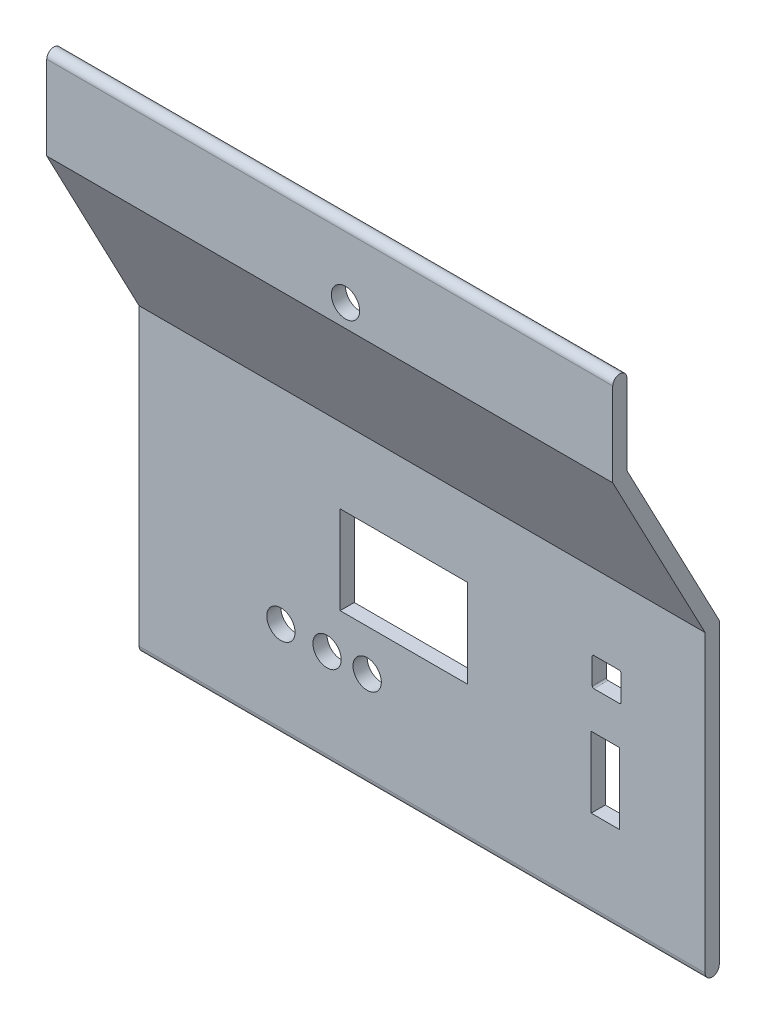
from build123d import *

# Parameters (mm, degrees)
SALIENTE_EXTRUIR3_DEPTH      = 110
SALIENTE_EXTRUIR3_DEPTH_BACK = 10
CORTAR_EXTRUIR3_START        = -3
CORTAR_EXTRUIR3_OUTLINE_R    = 3
CORTAR_EXTRUIR3_DEPTH        = 22.583018394


# Read off the part's stored shape, not the designer's step: Cortar-Extruir3
with BuildPart() as part:
    # Croquis9 → Saliente-Extruir3 (new, two sides: drawn at the far end of the back side and taken through both)
    with BuildSketch(Plane(origin=(0, 0, 0), x_dir=(0, 0, -1), z_dir=(1, 0, 0)).offset(-SALIENTE_EXTRUIR3_DEPTH_BACK)):
        with BuildLine():
            Line((5.538630524, -12.462), (5.538630524, 50.038))
            Line((5.538630524, 50.038), (-14.04438787, 87.324884341))
            Line((-14.04438787, 87.324884341), (-14.04438787, 93.670477998))
            Line((-14.04438787, 93.670477998), (-14.04438787, 105.09803176))
            ThreePointArc((-14.04438787, 105.09803176), (-12.54438787, 106.59803176), (-11.04438787, 105.09803176))
            Line((-11.04438787, 105.09803176), (-11.04438787, 93.670477998))
            Line((-11.04438787, 93.670477998), (-11.04438787, 88.064764588))
            Line((-11.04438787, 88.064764588), (8.538630524, 50.777880247))
            Line((8.538630524, 50.777880247), (8.538630524, -12.462))
            ThreePointArc((8.538630524, -12.462), (7.038630524, -13.962), (5.538630524, -12.462))
        make_face()
    extrude(amount=SALIENTE_EXTRUIR3_DEPTH + SALIENTE_EXTRUIR3_DEPTH_BACK)

    # Cortar-Extruir3 outline → Cortar-Extruir3 (cut)
    with BuildSketch(Plane.XY.offset(-5.538630524).offset(CORTAR_EXTRUIR3_START)):
        Polygon((91.833498399, 4.799000122), (91.833498399, 19.839000383), (85.846003394, 19.839000122), (85.846004052, 4.799000122), align=None)
        with Locations((20.066122073, 6.603918538)):
            Circle(CORTAR_EXTRUIR3_OUTLINE_R)
        with Locations((29.845121402, 6.476918682)):
            Circle(CORTAR_EXTRUIR3_OUTLINE_R)
        Polygon((59.620998024, 34.067003823), (32.620998024, 34.067001462), (32.620998024, 15.367003823), (59.620998024, 15.367003823), align=None)
        with BuildLine():
            Line((92.16369837, 28.270001136), (92.163697895, 33.705601107))
            ThreePointArc((92.163697895, 33.705601107), (92.066984544, 33.939087777), (91.833497866, 34.035801107))
            Line((91.833497866, 34.035801107), (86.397897866, 34.035800632))
            ThreePointArc((86.397897866, 34.035800632), (86.164411215, 33.939087271), (86.067697895, 33.705600603))
            Line((86.067697895, 33.705600603), (86.06769837, 28.270000603))
            ThreePointArc((86.06769837, 28.270000603), (86.164411732, 28.036513952), (86.397898399, 27.939800632))
            Line((86.397898399, 27.939800632), (91.833498399, 27.939801107))
            ThreePointArc((91.833498399, 27.939801107), (92.066985049, 28.036514469), (92.16369837, 28.270001136))
        make_face()
        with Locations((38.35412218, 6.603918538)):
            Circle(CORTAR_EXTRUIR3_OUTLINE_R)
        with Locations((53.339878017, 92.075080872)):
            Circle(CORTAR_EXTRUIR3_OUTLINE_R)
    extrude(amount=CORTAR_EXTRUIR3_DEPTH, mode=Mode.SUBTRACT)


solid = part.part
